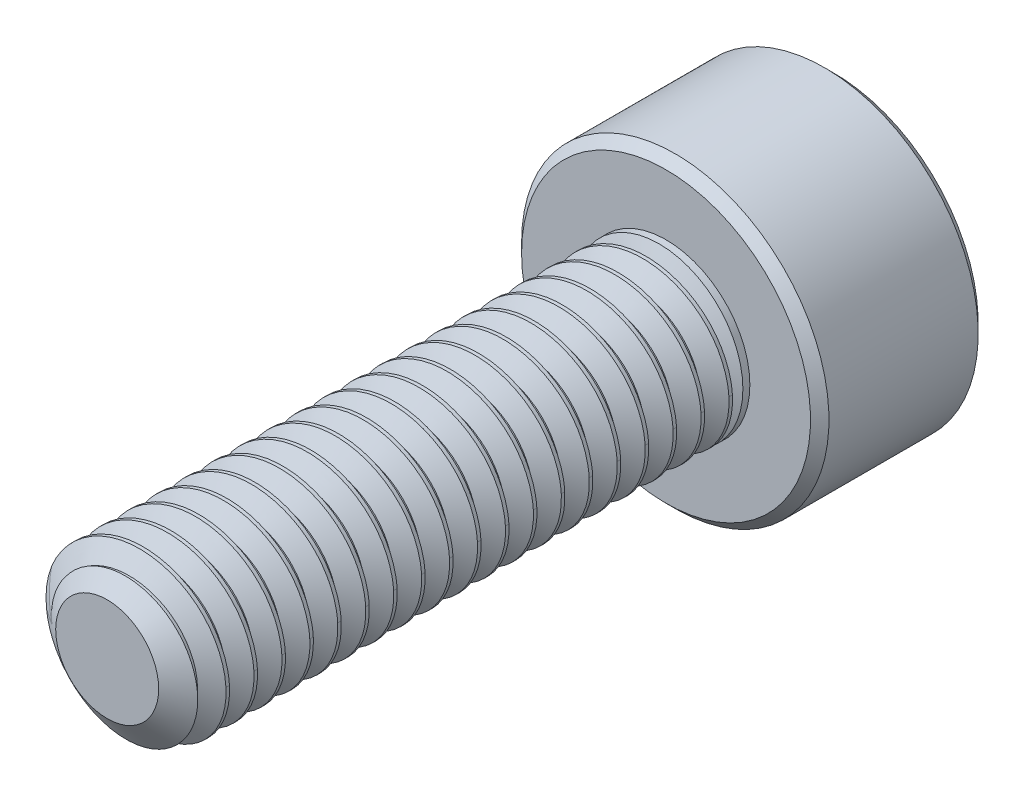
from build123d import *

# Parameters (mm, degrees)
SKETCH1_R          = 1.5
EXTRUDE1_DEPTH     = 10
CUT_SWEEP1_PITCH   = 0.5
SKETCH6_R          = 2.75
EXTRUDE2_DEPTH     = 3
CUT_EXTRUDE1_DEPTH = 1.875
CHAMFER1_SIZE      = 0.165


with BuildPart() as part:
    # Sketch1 → Extrude1 (new body)
    with BuildSketch(Plane.XY):
        Circle(SKETCH1_R)
    extrude(amount=-EXTRUDE1_DEPTH)

    # Cut-Sweep1: the profile of Sketch3 profile screwed along a right-hand helix of 21 turns, 6 arcs to a turn; built about Z, then put on its axis
    cut_sweep1_z = Axis((0, 0, 0), (0, 0, 1))
    cut_sweep1_corners = [(1.5003, 0, -0.437673205), (1.175240474, 0, -0.25), (1.175240474, 0, -0.1875), (1.5003, 0, 0.000173205)]
    with BuildLine(mode=Mode.PRIVATE) as cut_sweep1_profile:
        Line(cut_sweep1_corners[0], cut_sweep1_corners[1])
        Line(cut_sweep1_corners[1], cut_sweep1_corners[2])
        Line(cut_sweep1_corners[2], cut_sweep1_corners[3])
        Line(cut_sweep1_corners[3], cut_sweep1_corners[0])
    cut_sweep1_cap = Face(cut_sweep1_profile.wire())
    cut_sweep1_turn_angles = [0, 30, 60, 90, 120, 150, 180, 210, 240, 270, 300, 330, 360]
    cut_sweep1_turn_weights = [1, 0.8660254037844387, 1, 0.8660254037844387, 1, 0.8660254037844387, 1, 0.8660254037844387, 1, 0.8660254037844387, 1, 0.8660254037844387, 1]
    cut_sweep1_turn_rails = [Edge.make_bspline([Vector(p[0], p[1], 0).rotate(cut_sweep1_z, cut_sweep1_turn_angles[k]) / cut_sweep1_turn_weights[k] + Vector(0, 0, p[2] + CUT_SWEEP1_PITCH * cut_sweep1_turn_angles[k] / 360) for k in range(13)], [0, 0, 0, 1, 1, 2, 2, 3, 3, 4, 4, 5, 5, 6, 6, 6], 2, cut_sweep1_turn_weights) for p in cut_sweep1_corners]
    cut_sweep1_turn_sides = [Face.make_surface_from_curves(cut_sweep1_turn_rails[p[0]], cut_sweep1_turn_rails[p[1]]) for p in [(0, 1), (1, 2), (2, 3), (3, 0)]]
    cut_sweep1 = Plane(origin=(0, 0, 0), x_dir=(0, 1, 0), z_dir=(0, 0, -1)) * Solid(Shell([*[p.moved(Location((0, 0, CUT_SWEEP1_PITCH * i))) for i in range(21) for p in cut_sweep1_turn_sides], cut_sweep1_cap, cut_sweep1_cap.rotate(cut_sweep1_z, 7560).moved(Location((0, 0, CUT_SWEEP1_PITCH * 7560 / 360)))]))
    add(cut_sweep1, mode=Mode.SUBTRACT)

    # Sketch4 → Cut-Revolve1 (revolve, cut)
    with BuildSketch(Plane(origin=(0, 0, 0), x_dir=(0, 0, -1), z_dir=(1, 0, 0)), mode=Mode.PRIVATE) as cut_revolve1_sk:
        Polygon((0.405251783, 1.5), (0, 0.921240474), (0, 1.5), align=None)
    revolve(cut_revolve1_sk.sketch.rotate(Axis((0, 0, 0), (0, 0, -1)), 90), axis=Axis((0, 0, 0), (0, 0, -1)), mode=Mode.SUBTRACT)

    # Sketch6 → Extrude2 (add)
    with BuildSketch(Plane(origin=(0, 0, -10), x_dir=(-1, 0, 0), z_dir=(0, 0, -1))):
        Circle(SKETCH6_R)
    extrude(amount=EXTRUDE2_DEPTH)

    # Sketch7 → Cut-Extrude1 (cut)
    with BuildSketch(Plane(origin=(0, 0, -13), x_dir=(-1, 0, 0), z_dir=(0, 0, -1))):
        Polygon((0, 1.443375673), (-1.25, 0.721687836), (-1.25, -0.721687836), (0, -1.443375673), (1.25, -0.721687836), (1.25, 0.721687836), align=None)
    extrude(amount=-CUT_EXTRUDE1_DEPTH, mode=Mode.SUBTRACT)

    # Cut-Extrude2 cone 1 section (through the dimple's axis) → Cut-Extrude2 (revolve, cut)
    with BuildSketch(Plane(origin=(0, 0, -13), x_dir=(0, 1, 0), z_dir=(1, 0, 0))):
        Polygon((0, 0), (1.443375673, 0), (0, 1.443375673), align=None)
    revolve(axis=Axis((0, 0, -13), (0, 0, 1)), mode=Mode.SUBTRACT)

    # Chamfer1
    chamfer1_edges = [part.edges().sort_by_distance(p)[0] for p in [
        (2.75, 0, -10),
        (2.75, 0, -13),
    ]]
    chamfer(chamfer1_edges, length=CHAMFER1_SIZE)

    # Sketch10 → Revolve1 (revolve)
    with BuildSketch(Plane(origin=(0, 0, 0), x_dir=(0, 0, -1), z_dir=(1, 0, 0)), mode=Mode.PRIVATE) as revolve1_sk:
        Polygon((10, 1.5), (10, 0), (9.253679656, 0), (9.875, 1.5), align=None)
    revolve(revolve1_sk.sketch.rotate(Axis((0, 0, -10), (0, 0, 1)), 270), axis=Axis((0, 0, -10), (0, 0, 1)))


solid = part.part
